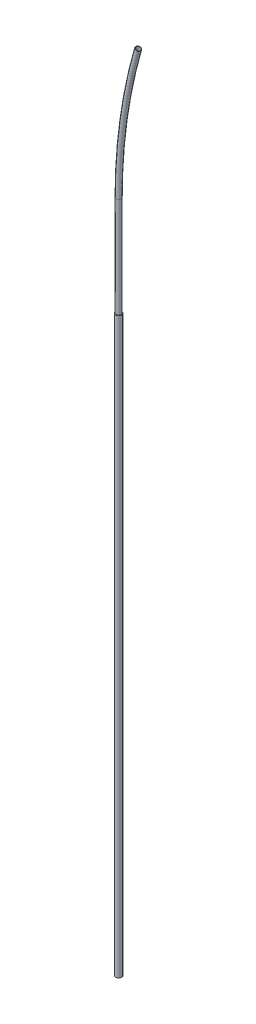
from build123d import *

# Parameters (mm, degrees)
SKETCH1_R           = 1.265
SKETCH1_R_2         = 1.105
BOSS_EXTRUDE1_DEPTH = 60
SWEEP2_OUTLINE_R    = 1.265
SWEEP2_OUTLINE_R_2  = 1.105
SWEEP2_ANGLE        = 16.042818
SKETCH4_R           = 1.524
SKETCH4_R_2         = 1.27
BOSS_EXTRUDE2_DEPTH = 286


# Read off the part's stored shape, not the designer's step: Sweep2
with BuildPart() as part:
    # Sketch1 → Boss-Extrude1 (new body)
    with BuildSketch(Plane(origin=(0, 0, 0), x_dir=(1, 0, 0), z_dir=(0, 1, 0))):
        with Locations(Location((0, 0, 0), (0, 0, 270))):
            Circle(SKETCH1_R)
        with Locations(Location((0, 0, 0), (0, 0, 270))):
            Circle(SKETCH1_R_2, mode=Mode.SUBTRACT)
    extrude(amount=BOSS_EXTRUDE1_DEPTH)


with BuildPart() as sweep2_tool:
    # Sweep2 outline → Sweep2 (revolve)
    with BuildSketch(Plane(origin=(250, 60, 0), x_dir=(-0.9610554383107709, 0.2763556485641141, 0), z_dir=(0.2763556485641141, 0.9610554383107709, 0))):
        with Locations((250, 0)):
            Circle(SWEEP2_OUTLINE_R)
        with Locations((250, 0)):
            Circle(SWEEP2_OUTLINE_R_2, mode=Mode.SUBTRACT)
    revolve(axis=Axis((250, 60, 0), (0, 0, 1)), revolution_arc=SWEEP2_ANGLE)


with BuildPart() as part_1:
    add(part.part)


with BuildPart() as part_2:
    # Sweep2: joined with sweep2_tool
    add(part_1.part.fuse(sweep2_tool.part, tol=0.00001))


with BuildPart() as body_2:
    # Sketch4 → Boss-Extrude2 (new body)
    with BuildSketch(Plane(origin=(0, 10, 0), x_dir=(-1, 0, 0), z_dir=(0, -1, 0))):
        with Locations(Location((0, 0, 0), (0, 0, 90))):
            Circle(SKETCH4_R)
        with Locations(Location((0, 0, 0), (0, 0, 90))):
            Circle(SKETCH4_R_2, mode=Mode.SUBTRACT)
    extrude(amount=BOSS_EXTRUDE2_DEPTH)


solid = Compound([part_2.part, body_2.part])
